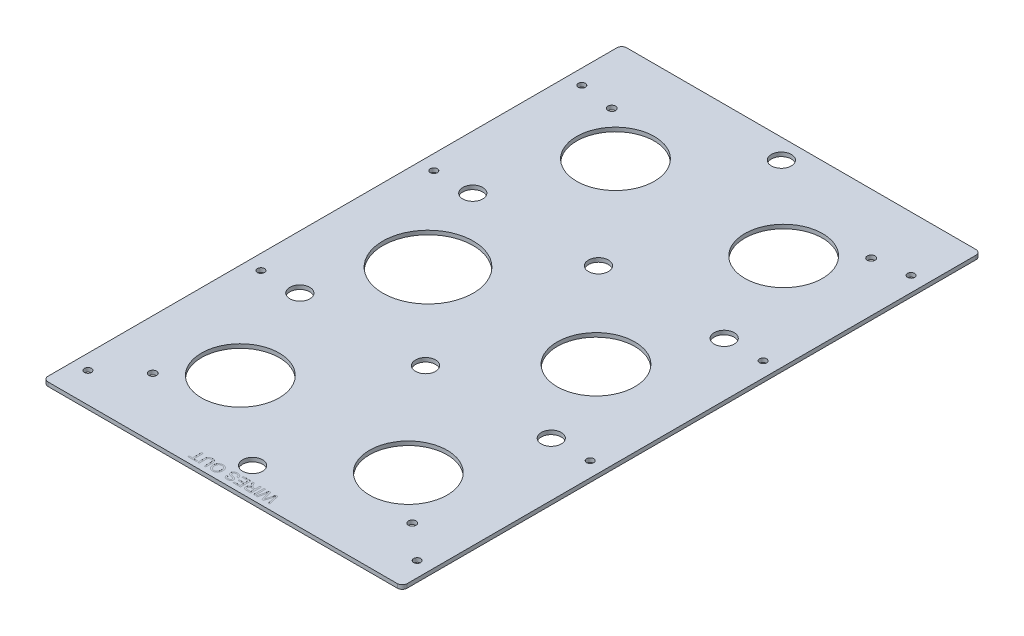
from build123d import *

# Parameters (mm, degrees)
SKETCH1_R           = 24.727
SKETCH1_R_2         = 28.76928198
SKETCH1_R_3         = 6.35
SKETCH1_R_4         = 2.45745
SKETCH1_R_5         = 2.2479
BOSS_EXTRUDE1_DEPTH = 2.54
SKETCH2_W           = 0.941716851
SKETCH2_H           = 6.67762858
CUT_EXTRUDE2_DEPTH  = 0.0254


with BuildPart() as part:
    # Sketch1 → Boss-Extrude1 (new body)
    with BuildSketch(Plane(origin=(0, 0, 0), x_dir=(1, 0, 0), z_dir=(0, 1, 0))):
        with BuildLine():
            Line((447.554094974, -114.738911078), (669.804094974, -114.738911078))
            ThreePointArc((669.804094974, -114.738911078), (672.049159004, -115.668847048), (672.979094974, -117.913911078))
            Line((672.979094974, -117.913911078), (672.979094974, -479.863911078))
            ThreePointArc((672.979094974, -479.863911078), (672.049159004, -482.108975108), (669.804094974, -483.038911078))
            Line((669.804094974, -483.038911078), (447.554094974, -483.038911078))
            ThreePointArc((447.554094974, -483.038911078), (445.309030943, -482.108975108), (444.379094974, -479.863911078))
            Line((444.379094974, -479.863911078), (444.379094974, -117.913911078))
            ThreePointArc((444.379094974, -117.913911078), (445.309030943, -115.668847048), (447.554094974, -114.738911078))
        make_face()
        with Locations((612.196894974, -418.397492761)):
            Circle(SKETCH1_R, mode=Mode.SUBTRACT)
        with Locations((612.196894974, -298.95320192)):
            Circle(SKETCH1_R, mode=Mode.SUBTRACT)
        with Locations((505.161294974, -418.268911078)):
            Circle(SKETCH1_R, mode=Mode.SUBTRACT)
        with Locations((505.161294974, -179.508911078)):
            Circle(SKETCH1_R, mode=Mode.SUBTRACT)
        with Locations((612.196894974, -179.508911078)):
            Circle(SKETCH1_R, mode=Mode.SUBTRACT)
        with Locations((505.161294974, -298.824620236)):
            Circle(SKETCH1_R_2, mode=Mode.SUBTRACT)
        with Locations((558.679094974, -463.988911078)):
            Circle(SKETCH1_R_3, mode=Mode.SUBTRACT)
        with Locations((638.689094974, -353.918011078)):
            Circle(SKETCH1_R_3, mode=Mode.SUBTRACT)
        with Locations((558.679094974, -353.922244411)):
            Circle(SKETCH1_R_3, mode=Mode.SUBTRACT)
        with Locations((478.669094974, -353.918011078)):
            Circle(SKETCH1_R_3, mode=Mode.SUBTRACT)
        with Locations((638.689094974, -243.859811078)):
            Circle(SKETCH1_R_3, mode=Mode.SUBTRACT)
        with Locations((558.679094974, -243.855577744)):
            Circle(SKETCH1_R_3, mode=Mode.SUBTRACT)
        with Locations((478.669094974, -243.859811078)):
            Circle(SKETCH1_R_3, mode=Mode.SUBTRACT)
        with Locations((558.679094974, -127.438911078)):
            Circle(SKETCH1_R_3, mode=Mode.SUBTRACT)
        with Locations((641.229094974, -152.838911078)):
            Circle(SKETCH1_R_4, mode=Mode.SUBTRACT)
        with Locations((476.129094974, -152.838911078)):
            Circle(SKETCH1_R_4, mode=Mode.SUBTRACT)
        with Locations((476.129094974, -444.938911078)):
            Circle(SKETCH1_R_4, mode=Mode.SUBTRACT)
        with Locations((641.229094974, -444.938911078)):
            Circle(SKETCH1_R_4, mode=Mode.SUBTRACT)
        with Locations((453.904094974, -149.663911078)):
            Circle(SKETCH1_R_5, mode=Mode.SUBTRACT)
        with Locations((453.904094974, -243.855577744)):
            Circle(SKETCH1_R_5, mode=Mode.SUBTRACT)
        with Locations((663.454094974, -149.663911078)):
            Circle(SKETCH1_R_5, mode=Mode.SUBTRACT)
        with Locations((663.454094974, -243.855577744)):
            Circle(SKETCH1_R_5, mode=Mode.SUBTRACT)
        with Locations((663.454094974, -353.922244411)):
            Circle(SKETCH1_R_5, mode=Mode.SUBTRACT)
        with Locations((453.904094974, -353.922244411)):
            Circle(SKETCH1_R_5, mode=Mode.SUBTRACT)
        with Locations((453.904094974, -463.988911078)):
            Circle(SKETCH1_R_5, mode=Mode.SUBTRACT)
        with Locations((663.454094974, -463.988911078)):
            Circle(SKETCH1_R_5, mode=Mode.SUBTRACT)
    extrude(amount=BOSS_EXTRUDE1_DEPTH)

    # Sketch2 → Cut-Extrude2 (cut)
    # profile 1 of 8: a face of its own
    with BuildSketch(Plane(origin=(0, 2.54, 0), x_dir=(1, 0, 0), z_dir=(0, 1, 0))):
        with BuildLine():
            Line((583.704685187, -473.038911078), (585.386131326, -479.716539658))
            Line((585.386131326, -479.716539658), (584.413648157, -479.716539658))
            Line((584.413648157, -479.716539658), (583.422437665, -475.324982241))
            add(Edge.make_bspline(
                [(583.422437665, -475.324982241), (583.371066972, -475.098491886), (583.268850039, -474.647823457), (583.167743642, -474.196904586), (583.117449821, -473.972601933)],
                knots=[0, 0, 0, 0, 1.00513078, 2, 2, 2, 2], degree=3))
            add(Edge.make_bspline(
                [(583.117449821, -473.972601933), (583.093637275, -474.053255615), (583.048683526, -474.205515071), (582.987914771, -474.421357522), (582.932720457, -474.609738812), (582.885697734, -474.771537145), (582.847623617, -474.90697984), (582.814750857, -475.014402582), (582.792345195, -475.095909061), (582.779067559, -475.140843853), (582.773669664, -475.159111659)],
                knots=[0, 0, 0, 0, 1.633809233, 3.084334118, 4.356383392, 5.447555203, 6.357852567, 7.089694452, 7.629924063, 8, 8, 8, 8], degree=3))
            Line((582.773669664, -475.159111659), (581.454731006, -479.716539658))
            Line((581.454731006, -479.716539658), (580.321727919, -479.716539658))
            Line((580.321727919, -479.716539658), (579.367972074, -476.371037038))
            add(Edge.make_bspline(
                [(579.367972074, -476.371037038), (579.315338033, -476.164365008), (579.211555093, -475.756852491), (579.073662708, -475.149847502), (578.946392444, -474.557568576), (578.873082381, -474.165840554), (578.83691868, -473.972601933)],
                knots=[0, 0, 0, 0, 1.04154457, 2.053700482, 3.039894486, 4, 4, 4, 4], degree=3))
            add(Edge.make_bspline(
                [(578.83691868, -473.972601933), (578.814538143, -474.071123954), (578.767259555, -474.279250421), (578.694553449, -474.607719652), (578.61203509, -474.968135632), (578.555891598, -475.219280198), (578.526580172, -475.350397894)],
                knots=[0, 0, 0, 0, 0.858436457, 1.813435672, 2.858437265, 4, 4, 4, 4], degree=3))
            Line((578.526580172, -475.350397894), (577.540720343, -479.716539658))
            Line((577.540720343, -479.716539658), (576.568237175, -479.716539658))
            Line((576.568237175, -479.716539658), (578.25102098, -473.038911078))
            Line((578.25102098, -473.038911078), (579.286374449, -473.038911078))
            Line((579.286374449, -473.038911078), (580.681560068, -478.142106798))
            add(Edge.make_bspline(
                [(580.681560068, -478.142106798), (580.695569742, -478.191995279), (580.722182904, -478.286764816), (580.757066528, -478.422004158), (580.791659564, -478.540941594), (580.819174913, -478.645114197), (580.842987144, -478.73347223), (580.864073893, -478.805756997), (580.877636323, -478.863383224), (580.887444042, -478.896136257), (580.891573627, -478.909927072)],
                knots=[0, 0, 0, 0, 1.562239628, 2.967673567, 4.210417925, 5.296319877, 6.215971374, 6.969386481, 7.566055473, 8, 8, 8, 8], degree=3))
            add(Edge.make_bspline(
                [(580.891573627, -478.909927072), (580.916399246, -478.822491273), (580.963424361, -478.65686887), (581.031908734, -478.424002997), (581.090788123, -478.219663107), (581.127429724, -478.093499428), (581.144392498, -478.035093519)],
                knots=[0, 0, 0, 0, 1.197732026, 2.268764715, 3.198546125, 4, 4, 4, 4], degree=3))
            Line((581.144392498, -478.035093519), (582.590409424, -473.038911078))
            Line((582.590409424, -473.038911078), (583.704685187, -473.038911078))
        make_face()
    # profile 2 of 8: a face of its own
    with BuildSketch(Plane(origin=(0, 2.54, 0), x_dir=(1, 0, 0), z_dir=(0, 1, 0))):
        with Locations((575.412493767, -476.377725368)):
            Rectangle(SKETCH2_W, SKETCH2_H)
    # profile 3 of 8: a face of its own
    with BuildSketch(Plane(origin=(0, 2.54, 0), x_dir=(1, 0, 0), z_dir=(0, 1, 0))):
        with BuildLine():
            Line((573.40064413, -473.038911078), (573.40064413, -479.716539658))
            Line((573.40064413, -479.716539658), (570.503259613, -479.716539658))
            add(Edge.make_bspline(
                [(570.503259613, -479.716539658), (570.435034755, -479.716007624), (570.302993526, -479.714977934), (570.111511779, -479.707620013), (569.933205066, -479.691988104), (569.766949623, -479.674529175), (569.613029937, -479.648750724), (569.471372654, -479.618507951), (569.342521062, -479.582764511), (569.225494742, -479.540514282), (569.116911011, -479.49273014), (569.016290738, -479.433739651), (568.919313484, -479.369209991), (568.829844976, -479.292765866), (568.743855584, -479.210634918), (568.664945431, -479.118707702), (568.590779174, -479.01928507), (568.500602804, -478.875311263), (568.405893063, -478.682324631), (568.324317958, -478.437137079), (568.272446963, -478.180396268), (568.266847675, -478.005021348), (568.26400676, -477.916041247)],
                knots=[0, 0, 0, 0, 1.242075696, 2.40389213, 3.487198984, 4.500157661, 5.446319301, 6.326791195, 7.136300648, 7.878370406, 8.590488565, 9.292260633, 9.999224673, 10.708050372, 11.431369221, 12.162165018, 12.910600795, 13.687589445, 15.252257874, 16.810406251, 18.381693487, 20, 20, 20, 20], degree=3))
            add(Edge.make_bspline(
                [(568.26400676, -477.916041247), (568.265313466, -477.85891975), (568.267894299, -477.746100875), (568.287663453, -477.580226748), (568.323434907, -477.421741389), (568.369302238, -477.269253537), (568.432089981, -477.12493565), (568.504793611, -476.985795531), (568.594990125, -476.855821149), (568.695699367, -476.730668634), (568.812805987, -476.61598588), (568.94306826, -476.509991425), (569.090402397, -476.419030361), (569.249976105, -476.334498044), (569.425901855, -476.265075007), (569.615526519, -476.203945773), (569.820317687, -476.156813408), (569.962261495, -476.133072319), (570.03507652, -476.1208935)],
                knots=[0, 0, 0, 0, 0.982645791, 1.940792824, 2.867691729, 3.775150443, 4.675643875, 5.571354211, 6.471357401, 7.392684514, 8.331098131, 9.285922955, 10.275520706, 11.304845665, 12.388884831, 13.524255008, 14.729980297, 16, 16, 16, 16], degree=3))
            add(Edge.make_bspline(
                [(570.03507652, -476.1208935), (569.981146161, -476.094011712), (569.878872059, -476.043032807), (569.739698901, -475.958684466), (569.617777025, -475.879277721), (569.548520366, -475.819733857), (569.516062119, -475.791827668)],
                knots=[0, 0, 0, 0, 1.172551213, 2.223638478, 3.167479604, 4, 4, 4, 4], degree=3))
            add(Edge.make_bspline(
                [(569.516062119, -475.791827668), (569.452873968, -475.730075234), (569.323285476, -475.603431162), (569.146445054, -475.385718714), (568.971463564, -475.146297331), (568.866408332, -474.971826562), (568.812449813, -474.882214801)],
                knots=[0, 0, 0, 0, 0.918170575, 1.883016652, 2.912673989, 4, 4, 4, 4], degree=3))
            Line((568.812449813, -474.882214801), (567.716901374, -473.038911078))
            Line((567.716901374, -473.038911078), (568.796397821, -473.038911078))
            Line((568.796397821, -473.038911078), (569.628426061, -474.448811022))
            add(Edge.make_bspline(
                [(569.628426061, -474.448811022), (569.65834345, -474.498277829), (569.716318436, -474.594136377), (569.800031216, -474.734153326), (569.882219294, -474.862988199), (569.958076937, -474.984651638), (570.032414923, -475.095935127), (570.099053954, -475.20105024), (570.165976922, -475.294042156), (570.242819342, -475.40576136), (570.336663093, -475.526550026), (570.446172116, -475.650635117), (570.546858376, -475.753421697), (570.674091164, -475.851493758), (570.832298465, -475.941288307), (570.965689781, -475.983884438), (571.03030001, -476.004516559)],
                knots=[0, 0, 0, 0, 1.130591283, 2.190900266, 3.190104209, 4.119071823, 4.994606968, 5.807262858, 6.55236009, 7.234593472, 8.459046683, 9.540234366, 10.471327768, 11.266723835, 12.676093724, 14, 14, 14, 14], degree=3))
            add(Edge.make_bspline(
                [(571.03030001, -476.004516559), (571.057442647, -476.009411299), (571.119410102, -476.020586137), (571.224630684, -476.027884442), (571.352118329, -476.035630616), (571.444510797, -476.035404918), (571.494470106, -476.035282877)],
                knots=[0, 0, 0, 0, 0.709978628, 1.620902492, 2.713552433, 4, 4, 4, 4], degree=3))
            Line((571.494470106, -476.035282877), (572.458927279, -476.035282877))
            Line((572.458927279, -476.035282877), (572.458927279, -473.038911078))
            Line((572.458927279, -473.038911078), (573.40064413, -473.038911078))
        make_face()
        with BuildLine():
            Line((572.458927279, -476.805778482), (570.670467861, -476.805778482))
            add(Edge.make_bspline(
                [(570.670467861, -476.805778482), (570.580783678, -476.807169477), (570.41312751, -476.809769811), (570.178746479, -476.832314365), (569.978256618, -476.867554733), (569.809096959, -476.921078915), (569.66693476, -476.992758357), (569.543722449, -477.080415378), (569.440122412, -477.189164531), (569.354920328, -477.313861571), (569.288315551, -477.449755477), (569.24177551, -477.593582493), (569.210530156, -477.742584665), (569.207335369, -477.844540111), (569.205723611, -477.895976257)],
                knots=[0, 0, 0, 0, 1.546056516, 2.890207646, 4.055830773, 5.050253158, 5.937355789, 6.790906573, 7.644595853, 8.512568064, 9.38593768, 10.244184789, 11.114197691, 12, 12, 12, 12], degree=3))
            add(Edge.make_bspline(
                [(569.205723611, -477.895976257), (569.206960947, -477.933460833), (569.209384525, -478.006882105), (569.222224943, -478.114608982), (569.246654953, -478.216697619), (569.28038947, -478.313883923), (569.323102291, -478.406378898), (569.375589591, -478.493818756), (569.437580539, -478.57575689), (569.508691424, -478.652596686), (569.590310946, -478.722524001), (569.683547605, -478.782853263), (569.787656863, -478.834120912), (569.902762329, -478.874810129), (570.028500653, -478.907354943), (570.165587853, -478.929005942), (570.313396936, -478.944672537), (570.415820061, -478.94557834), (570.468480298, -478.946044053)],
                knots=[0, 0, 0, 0, 0.965235723, 1.89061323, 2.787065514, 3.661873922, 4.534873316, 5.404925039, 6.281839248, 7.175200054, 8.095223355, 9.040740021, 10.02630299, 11.075573487, 12.177989335, 13.364883635, 14.645170704, 16, 16, 16, 16], degree=3))
            Line((570.468480298, -478.946044053), (572.458927279, -478.946044053))
            Line((572.458927279, -478.946044053), (572.458927279, -476.805778482))
        make_face(mode=Mode.SUBTRACT)
    # profile 4 of 8: a face of its own
    with BuildSketch(Plane(origin=(0, 2.54, 0), x_dir=(1, 0, 0), z_dir=(0, 1, 0))):
        Polygon((566.723015549, -473.038911078), (566.723015549, -479.716539658), (562.014431294, -479.716539658), (562.014431294, -478.946044053), (565.781298698, -478.946044053), (565.781298698, -476.891389105), (562.271263162, -476.891389105), (562.271263162, -476.1208935), (565.781298698, -476.1208935), (565.781298698, -473.809406683), (561.843210048, -473.809406683), (561.843210048, -473.038911078), align=None)
    # profile 5 of 8: a face of its own
    with BuildSketch(Plane(origin=(0, 2.54, 0), x_dir=(1, 0, 0), z_dir=(0, 1, 0))):
        with BuildLine():
            Line((560.901493197, -475.350397894), (559.959776346, -475.350397894))
            add(Edge.make_bspline(
                [(559.959776346, -475.350397894), (559.949441643, -475.265831844), (559.929588123, -475.103375909), (559.87363622, -474.873323583), (559.803149924, -474.665944967), (559.710403482, -474.481452899), (559.596486816, -474.315456907), (559.453959198, -474.168454605), (559.282808127, -474.039412214), (559.087068688, -473.929072993), (558.872890157, -473.836127961), (558.642163114, -473.77092541), (558.398302582, -473.731386531), (558.231217596, -473.72636178), (558.145901274, -473.72379606)],
                knots=[0, 0, 0, 0, 1.125761249, 2.162647979, 3.12492346, 4.01623828, 4.884793378, 5.777219259, 6.711258599, 7.709587174, 8.742442187, 9.791331093, 10.872217593, 12, 12, 12, 12], degree=3))
            add(Edge.make_bspline(
                [(558.145901274, -473.72379606), (558.070417669, -473.72519974), (557.923680894, -473.727928431), (557.710566725, -473.76049425), (557.510597694, -473.80867252), (557.325934155, -473.877963939), (557.160287267, -473.965063904), (557.013254484, -474.064518239), (556.891306346, -474.183042155), (556.792662447, -474.314041031), (556.716109259, -474.453150197), (556.662739066, -474.596662621), (556.626806756, -474.741783675), (556.622901048, -474.840095913), (556.620962055, -474.88890313)],
                knots=[0, 0, 0, 0, 1.267544124, 2.464049433, 3.614542348, 4.719673496, 5.768837234, 6.754183997, 7.692231426, 8.612479311, 9.501217876, 10.350240008, 11.180974857, 12, 12, 12, 12], degree=3))
            add(Edge.make_bspline(
                [(556.620962055, -474.88890313), (556.623007732, -474.937231481), (556.62701011, -475.031786208), (556.658760129, -475.168660842), (556.71006501, -475.296018864), (556.782033163, -475.414946747), (556.87984428, -475.524725318), (557.00632581, -475.622175985), (557.157954383, -475.714867252), (557.27211533, -475.764299624), (557.332600358, -475.790490002)],
                knots=[0, 0, 0, 0, 0.942081658, 1.843188798, 2.725198023, 3.611401405, 4.541884661, 5.575766242, 6.715586633, 8, 8, 8, 8], degree=3))
            add(Edge.make_bspline(
                [(557.332600358, -475.790490002), (557.35612593, -475.800144256), (557.409274471, -475.821954969), (557.500369464, -475.85082561), (557.608460588, -475.888174698), (557.735759482, -475.926440127), (557.882398046, -475.967439808), (558.047031179, -476.014623884), (558.230964979, -476.063758672), (558.427757945, -476.115775065), (558.626956311, -476.168534701), (558.817239772, -476.222480414), (558.993389362, -476.273645466), (559.154734571, -476.326231572), (559.301429911, -476.378132311), (559.433876155, -476.429012304), (559.552308909, -476.477605417), (559.624641358, -476.513342085), (559.6588015, -476.53021929)],
                knots=[0, 0, 0, 0, 0.499208779, 1.12780332, 1.87546358, 2.745246929, 3.737578632, 4.865834649, 6.108484299, 7.476352792, 8.863398792, 10.155242256, 11.360521946, 12.465428895, 13.487415091, 14.415997097, 15.251929613, 16, 16, 16, 16], degree=3))
            add(Edge.make_bspline(
                [(559.6588015, -476.53021929), (559.737344859, -476.572728755), (559.888953983, -476.654783084), (560.093793376, -476.800625351), (560.263492789, -476.965615264), (560.403438036, -477.143384174), (560.511484943, -477.33485335), (560.587822191, -477.537925687), (560.637398056, -477.751808904), (560.642213266, -477.898820101), (560.644661328, -477.973560884)],
                knots=[0, 0, 0, 0, 1.158956011, 2.237086722, 3.252429106, 4.221720014, 5.165272549, 6.094237939, 7.031106807, 8, 8, 8, 8], degree=3))
            add(Edge.make_bspline(
                [(560.644661328, -477.973560884), (560.641487449, -478.056349046), (560.635174626, -478.221014098), (560.579036526, -478.462602453), (560.489625003, -478.695832438), (560.38663044, -478.880423084), (560.287658383, -479.020579884), (560.204477397, -479.11996029), (560.112690339, -479.212383084), (560.014304466, -479.299765857), (559.905767451, -479.378841254), (559.790330365, -479.45225428), (559.665628506, -479.518040128), (559.489076677, -479.598245304), (559.254248313, -479.680476734), (558.958579395, -479.751721279), (558.647375897, -479.793427053), (558.434962377, -479.799201409), (558.326486182, -479.802150281)],
                knots=[0, 0, 0, 0, 1.200056028, 2.386902731, 3.579012093, 4.815906327, 5.442508847, 6.067203999, 6.694073756, 7.331409728, 7.974631341, 8.640655778, 9.315145047, 10.018831381, 11.453504181, 12.917815188, 14.425977399, 16, 16, 16, 16], degree=3))
            add(Edge.make_bspline(
                [(558.326486182, -479.802150281), (558.207733605, -479.799515114), (557.976941663, -479.794393748), (557.641354111, -479.74922783), (557.327416648, -479.676449439), (557.081665155, -479.590705881), (556.899502856, -479.505477823), (556.771102016, -479.436798514), (556.651510992, -479.35939628), (556.538447673, -479.277441688), (556.435952708, -479.185596336), (556.33979295, -479.088690521), (556.251586122, -478.9848562), (556.146837991, -478.836554819), (556.036193109, -478.638222395), (555.936270997, -478.383839595), (555.872284601, -478.113363396), (555.857816492, -477.927518361), (555.85046645, -477.833105956)],
                knots=[0, 0, 0, 0, 1.607451709, 3.124032445, 4.575401297, 5.965664223, 6.638286369, 7.297495781, 7.935629741, 8.566004073, 9.186263309, 9.796807256, 10.413736732, 11.028594479, 12.253110936, 13.478624344, 14.719098735, 16, 16, 16, 16], degree=3))
            Line((555.85046645, -477.833105956), (556.792183301, -477.833105956))
            add(Edge.make_bspline(
                [(556.792183301, -477.833105956), (556.797970347, -477.880969796), (556.809305526, -477.97472147), (556.841104955, -478.109458987), (556.879141682, -478.236014668), (556.927509761, -478.352966146), (556.985235702, -478.461347583), (557.053708237, -478.559922836), (557.130217308, -478.650557542), (557.216608799, -478.731661115), (557.313700065, -478.802886782), (557.42151144, -478.86444356), (557.539643192, -478.9170562), (557.669241197, -478.957616394), (557.808572579, -478.99129841), (557.95924032, -479.015476198), (558.120717698, -479.028000887), (558.231938693, -479.030415294), (558.289031534, -479.031654676)],
                knots=[0, 0, 0, 0, 1.074256797, 2.104164074, 3.082231143, 4.018364317, 4.921387537, 5.814946689, 6.689553043, 7.561782592, 8.450683137, 9.368204304, 10.325224224, 11.328240899, 12.391723181, 13.519579538, 14.726730929, 16, 16, 16, 16], degree=3))
            add(Edge.make_bspline(
                [(558.289031534, -479.031654676), (558.348377721, -479.031213249), (558.463257343, -479.030358755), (558.629294286, -479.014495465), (558.783313677, -478.99311136), (558.92436606, -478.960285978), (559.05376766, -478.921666158), (559.169248724, -478.869806937), (559.273561651, -478.811347747), (559.36480405, -478.742823708), (559.443447939, -478.666854893), (559.514031858, -478.588817941), (559.570944454, -478.504630312), (559.621058926, -478.418953692), (559.655976583, -478.327231331), (559.683386152, -478.233453781), (559.700052674, -478.135560229), (559.701967222, -478.069045199), (559.702944477, -478.035093519)],
                knots=[0, 0, 0, 0, 1.464224776, 2.834379057, 4.11387117, 5.299348816, 6.406355048, 7.441191667, 8.417293255, 9.352838038, 10.248153785, 11.113750317, 11.944205591, 12.75240885, 13.557683963, 14.358962649, 15.162355132, 16, 16, 16, 16], degree=3))
            add(Edge.make_bspline(
                [(559.702944477, -478.035093519), (559.700510859, -477.977642138), (559.695787431, -477.866134305), (559.647554323, -477.707715286), (559.573371466, -477.563306086), (559.500289532, -477.484733778), (559.463502266, -477.445182822)],
                knots=[0, 0, 0, 0, 1.050964922, 2.039826012, 3.013306874, 4, 4, 4, 4], degree=3))
            add(Edge.make_bspline(
                [(559.463502266, -477.445182822), (559.440311967, -477.425417142), (559.389028052, -477.381706563), (559.293606399, -477.323860815), (559.175297819, -477.265414613), (559.033311147, -477.207316669), (558.867893646, -477.148849914), (558.679298732, -477.08869481), (558.46645156, -477.028641027), (558.236400506, -476.971708106), (558.004320499, -476.913251181), (557.784073918, -476.855650942), (557.581070151, -476.801822493), (557.397646601, -476.745782341), (557.230785076, -476.696627283), (557.083793222, -476.644727132), (556.954030239, -476.597628353), (556.874564229, -476.564383816), (556.837663944, -476.548946614)],
                knots=[0, 0, 0, 0, 0.523895407, 1.158562347, 1.913798076, 2.79478753, 3.797549825, 4.933675542, 6.202127117, 7.604032848, 9.013379355, 10.32225155, 11.523321485, 12.628397413, 13.623935419, 14.51727859, 15.311493772, 16, 16, 16, 16], degree=3))
            add(Edge.make_bspline(
                [(556.837663944, -476.548946614), (556.789642826, -476.526822324), (556.695385417, -476.483396051), (556.562012733, -476.409037643), (556.436752934, -476.332483422), (556.323506524, -476.248124734), (556.216708797, -476.163653215), (556.121806923, -476.072332315), (556.036759509, -475.976310851), (555.936017074, -475.844380858), (555.832678452, -475.666309028), (555.743891949, -475.436163571), (555.688353696, -475.190272403), (555.68231894, -475.020735522), (555.679245204, -474.934383774)],
                knots=[0, 0, 0, 0, 0.899363591, 1.76530001, 2.59691609, 3.395188894, 4.166615117, 4.912545108, 5.632755751, 6.347510175, 7.734752518, 9.118421309, 10.532299558, 12, 12, 12, 12], degree=3))
            add(Edge.make_bspline(
                [(555.679245204, -474.934383774), (555.682785219, -474.847127142), (555.689830999, -474.673458088), (555.748712231, -474.417850397), (555.843189187, -474.170678065), (555.952537103, -473.974585899), (556.056313703, -473.824585042), (556.143462477, -473.716762357), (556.24011311, -473.617066285), (556.343877167, -473.522369915), (556.455563103, -473.434607907), (556.576110276, -473.35374365), (556.70425259, -473.278960579), (556.88721117, -473.187730916), (557.130500458, -473.092992766), (557.439449904, -473.010820741), (557.766235131, -472.962129873), (557.99012047, -472.956284852), (558.104433629, -472.953300455)],
                knots=[0, 0, 0, 0, 1.196987384, 2.382393894, 3.582009067, 4.820735309, 5.454243406, 6.085350439, 6.72189866, 7.359035515, 8.013098289, 8.67027723, 9.350744424, 10.048966745, 11.475869723, 12.9268444, 14.430883741, 16, 16, 16, 16], degree=3))
            add(Edge.make_bspline(
                [(558.104433629, -472.953300455), (558.177129973, -472.953977439), (558.319976733, -472.955307697), (558.529415304, -472.968496322), (558.72954914, -472.992324432), (558.921178925, -473.019904767), (559.103400655, -473.06135733), (559.277259914, -473.108129269), (559.441170819, -473.166806249), (559.59693833, -473.231363773), (559.743136405, -473.307645041), (559.882834696, -473.389400674), (560.012652622, -473.48318437), (560.136436492, -473.582641324), (560.250451465, -473.693285363), (560.356016732, -473.812534511), (560.454279686, -473.94011778), (560.543498247, -474.076173097), (560.623145547, -474.219140407), (560.694848012, -474.366534782), (560.754853707, -474.519142449), (560.804303384, -474.676604641), (560.84478148, -474.838206548), (560.873643596, -475.005024634), (560.894595683, -475.176012368), (560.899180445, -475.29192604), (560.901493197, -475.350397894)],
                knots=[0, 0, 0, 0, 1.259929758, 2.475735005, 3.634725603, 4.752877801, 5.82919746, 6.871690464, 7.871395985, 8.84458164, 9.791640072, 10.727373556, 11.647336026, 12.564665335, 13.477425593, 14.397128332, 15.323044476, 16.266184727, 17.214251675, 18.157898412, 19.105082968, 20.053433368, 21.01687335, 21.990151059, 22.98614553, 24, 24, 24, 24], degree=3))
        make_face()
    # profile 6 of 8: a face of its own
    with BuildSketch(Plane(origin=(0, 2.54, 0), x_dir=(1, 0, 0), z_dir=(0, 1, 0))):
        with BuildLine():
            add(Edge.make_bspline(
                [(552.169209668, -476.289439413), (552.166873126, -476.423315191), (552.162320492, -476.684165353), (552.120284089, -477.064078739), (552.050936075, -477.421100913), (551.955540704, -477.756883394), (551.828661714, -478.068893747), (551.678113348, -478.36096868), (551.495449154, -478.62802459), (551.28905047, -478.873149268), (551.058449384, -479.089837579), (550.812940763, -479.282293084), (550.549439749, -479.442822423), (550.270385906, -479.575367077), (549.974592323, -479.677130938), (549.662889855, -479.748374922), (549.335611769, -479.79433421), (549.111909541, -479.799507081), (548.997603625, -479.802150281)],
                knots=[0, 0, 0, 0, 1.203593535, 2.345140965, 3.431924157, 4.471254512, 5.478692091, 6.45615896, 7.42038538, 8.382007041, 9.33218277, 10.260966195, 11.182476517, 12.100814648, 13.034113903, 13.98924309, 14.972556454, 16, 16, 16, 16], degree=3))
            add(Edge.make_bspline(
                [(548.997603625, -479.802150281), (548.922208644, -479.800845709), (548.772487849, -479.798255063), (548.550741845, -479.778149696), (548.33496047, -479.743241169), (548.125017258, -479.694677819), (547.920602532, -479.633580089), (547.721851237, -479.558120743), (547.528445783, -479.469844934), (547.342117859, -479.367246949), (547.164190757, -479.251797697), (546.995390694, -479.126697102), (546.83834011, -478.989436011), (546.692281093, -478.84183612), (546.556084607, -478.683973329), (546.434103204, -478.512899324), (546.31911696, -478.334017), (546.218303532, -478.143219905), (546.126913801, -477.944892358), (546.050309691, -477.738174777), (545.982470234, -477.526029717), (545.927693672, -477.307139543), (545.886862791, -477.080879739), (545.855465504, -476.848876167), (545.838511687, -476.6098394), (545.835532235, -476.448645271), (545.834023579, -476.36702404)],
                knots=[0, 0, 0, 0, 1.034176269, 2.053687022, 3.051235935, 4.030520976, 5.007759882, 5.975670013, 6.944584641, 7.921900115, 8.890679583, 9.85222947, 10.801660264, 11.7488817, 12.698942795, 13.658174729, 14.62880618, 15.613957309, 16.61577279, 17.622338666, 18.636016077, 19.670029534, 20.714984856, 21.788550191, 22.880224384, 24, 24, 24, 24], degree=3))
            add(Edge.make_bspline(
                [(545.834023579, -476.36702404), (545.835414909, -476.284058486), (545.838163721, -476.120145729), (545.856763311, -475.877996436), (545.889467854, -475.642798747), (545.932844862, -475.413851345), (545.990968729, -475.191630851), (546.060040014, -474.975500145), (546.143585631, -474.766746547), (546.237941143, -474.564866904), (546.344704318, -474.372637815), (546.462471515, -474.191403242), (546.591325391, -474.022859196), (546.729311485, -473.864935494), (546.879188567, -473.720901022), (547.039798976, -473.588611923), (547.210814268, -473.468637382), (547.391564093, -473.360269728), (547.579160691, -473.264982232), (547.771326257, -473.180774534), (547.968287426, -473.112643293), (548.167162617, -473.052213836), (548.370913224, -473.008761971), (548.577617977, -472.976383327), (548.788575561, -472.957449903), (548.930238022, -472.954690712), (549.001616623, -472.953300455)],
                knots=[0, 0, 0, 0, 1.141458971, 2.255149016, 3.338763392, 4.407145747, 5.45911027, 6.497028761, 7.526847988, 8.550472592, 9.561035647, 10.549629976, 11.521388012, 12.477647518, 13.432134385, 14.377847498, 15.337760086, 16.303574593, 17.274809663, 18.230970776, 19.187525402, 20.140611526, 21.088808525, 22.051011914, 23.017975238, 24, 24, 24, 24], degree=3))
            add(Edge.make_bspline(
                [(549.001616623, -472.953300455), (549.078354422, -472.954489343), (549.230352783, -472.956844232), (549.455247878, -472.978525154), (549.673804335, -473.015640338), (549.887272403, -473.062230098), (550.093276567, -473.127640714), (550.29354046, -473.204710539), (550.486579416, -473.29797652), (550.673385143, -473.403334425), (550.852284242, -473.520139128), (551.019483763, -473.649515058), (551.177450737, -473.786919278), (551.321374145, -473.937679006), (551.455564374, -474.097077963), (551.579570767, -474.266499456), (551.691641134, -474.446792165), (551.79115443, -474.636991664), (551.880889017, -474.832271099), (551.956533283, -475.032528558), (552.022998723, -475.234856709), (552.075934487, -475.440490921), (552.118117108, -475.648959956), (552.146482039, -475.859916096), (552.166967359, -476.073673746), (552.16845847, -476.217155589), (552.169209668, -476.289439413)],
                knots=[0, 0, 0, 0, 1.072846099, 2.125039441, 3.155166917, 4.171599398, 5.177324298, 6.174217088, 7.169783185, 8.172042761, 9.17156421, 10.154239632, 11.126115549, 12.096189878, 13.065322046, 14.038037562, 15.029377678, 16.03062832, 17.03785952, 18.032507603, 19.022297599, 20.014323703, 20.999862951, 21.994471951, 22.989647507, 24, 24, 24, 24], degree=3))
        make_face()
        with BuildLine():
            add(Edge.make_bspline(
                [(551.227492817, -476.278738085), (551.226050498, -476.182331479), (551.223238078, -475.9943454), (551.191032897, -475.720278789), (551.142224145, -475.461656512), (551.074749555, -475.217873773), (550.984662749, -474.990722679), (550.874521011, -474.779767032), (550.745322029, -474.584009739), (550.597133785, -474.40566925), (550.434307568, -474.245406413), (550.260308376, -474.105364122), (550.075297856, -473.988587709), (549.881725521, -473.8910491), (549.677024852, -473.815895959), (549.46217656, -473.762769421), (549.237184859, -473.729608328), (549.083776318, -473.72575762), (549.005629621, -473.72379606)],
                knots=[0, 0, 0, 0, 1.215616022, 2.370365452, 3.475740397, 4.533490648, 5.5560781, 6.552384115, 7.530550651, 8.509299237, 9.471863928, 10.40830403, 11.321168121, 12.226759389, 13.137923578, 14.065605683, 15.014614662, 16, 16, 16, 16], degree=3))
            add(Edge.make_bspline(
                [(549.005629621, -473.72379606), (548.926157631, -473.725785217), (548.770551697, -473.729679981), (548.542177913, -473.762281655), (548.325197234, -473.817784607), (548.117459084, -473.891671636), (547.922718837, -473.991554204), (547.736423323, -474.108516507), (547.563646267, -474.251439694), (547.400164861, -474.411990685), (547.253478236, -474.594465892), (547.123534081, -474.794466129), (547.017248342, -475.014476778), (546.928586984, -475.251333757), (546.859039479, -475.506523483), (546.810419261, -475.780043714), (546.78043557, -476.071173449), (546.77733315, -476.2710829), (546.77574043, -476.37371237)],
                knots=[0, 0, 0, 0, 0.976909331, 1.912785716, 2.828990727, 3.727421029, 4.617481149, 5.514840137, 6.426786422, 7.368873452, 8.327895072, 9.299698503, 10.295216142, 11.325792517, 12.405818789, 13.542541501, 14.738390493, 16, 16, 16, 16], degree=3))
            add(Edge.make_bspline(
                [(546.77574043, -476.37371237), (546.776309013, -476.439734433), (546.777424367, -476.569245829), (546.792195411, -476.760147103), (546.811248135, -476.945110274), (546.840256304, -477.123896579), (546.880232892, -477.295765965), (546.924521354, -477.462025647), (546.979898091, -477.62124732), (547.042746398, -477.774039322), (547.11301598, -477.919675351), (547.192475197, -478.056718093), (547.279436079, -478.185622262), (547.374799479, -478.305812428), (547.476154585, -478.418985775), (547.586727909, -478.522200101), (547.704697925, -478.617508813), (547.830079397, -478.703936883), (547.960860173, -478.781629121), (548.096376522, -478.848632477), (548.236196781, -478.905438476), (548.380177194, -478.949950669), (548.527451442, -478.986699959), (548.678374686, -479.013921415), (548.834129506, -479.028192811), (548.939166641, -479.030492434), (548.992252962, -479.031654676)],
                knots=[0, 0, 0, 0, 1.220320263, 2.393826742, 3.538159925, 4.657606474, 5.739544833, 6.799495376, 7.837090465, 8.853610905, 9.852768056, 10.824163015, 11.779900663, 12.724912201, 13.658747054, 14.586045767, 15.518168864, 16.460299482, 17.399069918, 18.328125852, 19.252745725, 20.186143833, 21.111865538, 22.057883325, 23.018444021, 24, 24, 24, 24], degree=3))
            add(Edge.make_bspline(
                [(548.992252962, -479.031654676), (549.067280601, -479.030139437), (549.215760297, -479.027140778), (549.433718789, -478.994736746), (549.644086092, -478.945953073), (549.845394595, -478.875487526), (550.039938697, -478.787023075), (550.225479592, -478.67688147), (550.403198071, -478.547372872), (550.572338874, -478.39904835), (550.72998374, -478.227930937), (550.863330816, -478.026318968), (550.975698346, -477.798879204), (551.0695292, -477.546229974), (551.141070798, -477.266402522), (551.190515453, -476.960604656), (551.22173367, -476.628513077), (551.225524024, -476.398310418), (551.227492817, -476.278738085)],
                knots=[0, 0, 0, 0, 0.895098135, 1.771399171, 2.624879489, 3.470001555, 4.31324378, 5.172350046, 6.041214072, 6.935108351, 7.854676913, 8.809932058, 9.809814619, 10.877726151, 12.02168834, 13.252153056, 14.572707754, 16, 16, 16, 16], degree=3))
        make_face(mode=Mode.SUBTRACT)
    # profile 7 of 8: a face of its own
    with BuildSketch(Plane(origin=(0, 2.54, 0), x_dir=(1, 0, 0), z_dir=(0, 1, 0))):
        with BuildLine():
            Line((540.44055434, -479.716539658), (539.498837489, -479.716539658))
            Line((539.498837489, -479.716539658), (539.498837489, -475.874762959))
            add(Edge.make_bspline(
                [(539.498837489, -475.874762959), (539.499816938, -475.793158881), (539.501722948, -475.634357212), (539.510442015, -475.402755904), (539.527589929, -475.18404963), (539.553268601, -474.978911472), (539.583957127, -474.786071265), (539.620212267, -474.606180294), (539.666412843, -474.439398968), (539.718270586, -474.283896515), (539.780022693, -474.138302785), (539.853045404, -474.000529425), (539.93697045, -473.869711261), (540.032743981, -473.746136221), (540.138843857, -473.629053782), (540.256518677, -473.519390051), (540.386296539, -473.417903754), (540.524886924, -473.320758333), (540.67593951, -473.233880326), (540.839121806, -473.158942965), (541.01338677, -473.09448562), (541.199582928, -473.042665895), (541.396855767, -473.003063948), (541.604919559, -472.973451723), (541.824288823, -472.955947825), (541.974379411, -472.95419598), (542.051104182, -472.953300455)],
                knots=[0, 0, 0, 0, 1.311377147, 2.551942077, 3.723550895, 4.835332178, 5.873100029, 6.860965504, 7.782222652, 8.65229484, 9.493385443, 10.320318369, 11.155067733, 11.987723446, 12.829729107, 13.691560723, 14.568860379, 15.475173283, 16.409214366, 17.364531151, 18.357450607, 19.391849073, 20.466818896, 21.588529868, 22.767281177, 24, 24, 24, 24], degree=3))
            add(Edge.make_bspline(
                [(542.051104182, -472.953300455), (542.126034765, -472.954403093), (542.27203116, -472.956551496), (542.485974248, -472.971088071), (542.689487871, -472.996823618), (542.883155391, -473.030677933), (543.066022983, -473.076174174), (543.237872145, -473.132779585), (543.399822732, -473.198068301), (543.552071516, -473.272611157), (543.692345886, -473.359338901), (543.824260009, -473.451962359), (543.94391161, -473.556335364), (544.053604413, -473.66852584), (544.153502225, -473.789455893), (544.241647678, -473.920278808), (544.32145664, -474.059118375), (544.3876969, -474.209562695), (544.447501129, -474.370135508), (544.497622451, -474.544213222), (544.540419738, -474.731796036), (544.574461527, -474.933317064), (544.603349975, -475.14869783), (544.620551649, -475.378723298), (544.633478123, -475.622243329), (544.63479776, -475.789132871), (544.635474859, -475.874762959)],
                knots=[0, 0, 0, 0, 1.193078897, 2.324621146, 3.412165798, 4.458033356, 5.453301711, 6.409727336, 7.336550967, 8.231923267, 9.10494906, 9.959977801, 10.795507141, 11.62892236, 12.456145611, 13.289107106, 14.138012467, 15.002334476, 15.903094886, 16.864671381, 17.884255983, 18.965082669, 20.117808422, 21.342986352, 22.636701193, 24, 24, 24, 24], degree=3))
            Line((544.635474859, -475.874762959), (544.635474859, -479.716539658))
            Line((544.635474859, -479.716539658), (543.693758008, -479.716539658))
            Line((543.693758008, -479.716539658), (543.693758008, -475.918905936))
            add(Edge.make_bspline(
                [(543.693758008, -475.918905936), (543.69314196, -475.849789935), (543.691953287, -475.71642959), (543.685768405, -475.52324046), (543.673347641, -475.343968185), (543.658182672, -475.178751914), (543.636861524, -475.027833095), (543.610059734, -474.891302271), (543.57977129, -474.768368844), (543.534609035, -474.624483335), (543.458541994, -474.464493985), (543.343327988, -474.291780168), (543.195628055, -474.146747152), (543.02449692, -474.023734386), (542.828938448, -473.927793435), (542.612395608, -473.857956185), (542.375090439, -473.816135264), (542.210014251, -473.811699706), (542.124675811, -473.809406683)],
                knots=[0, 0, 0, 0, 1.090438201, 2.104016592, 3.048763244, 3.925116223, 4.720979001, 5.45216101, 6.119252661, 6.717681473, 7.82855347, 8.901677854, 9.976092604, 11.075141713, 12.213970494, 13.397440122, 14.654570346, 16, 16, 16, 16], degree=3))
            add(Edge.make_bspline(
                [(542.124675811, -473.809406683), (542.051511524, -473.810651046), (541.910238691, -473.813053785), (541.706532063, -473.832465232), (541.519764727, -473.867770204), (541.348062028, -473.913623824), (541.192809029, -473.975108305), (541.05289069, -474.049566738), (540.932007513, -474.141064192), (540.822630208, -474.243773339), (540.730265746, -474.368806378), (540.653082175, -474.517394646), (540.586517926, -474.689660793), (540.532007518, -474.887242207), (540.492199616, -475.110377609), (540.4611008, -475.357672156), (540.444789358, -475.630199902), (540.442006651, -475.819900254), (540.44055434, -475.918905936)],
                knots=[0, 0, 0, 0, 1.111591514, 2.146370713, 3.104407205, 3.996889121, 4.842307775, 5.6365848, 6.396727704, 7.139400744, 7.909024799, 8.745519786, 9.676513234, 10.710427131, 11.854494362, 13.117490512, 14.495602074, 16, 16, 16, 16], degree=3))
            Line((540.44055434, -475.918905936), (540.44055434, -479.716539658))
        make_face()
    # profile 8 of 8: a face of its own
    with BuildSketch(Plane(origin=(0, 2.54, 0), x_dir=(1, 0, 0), z_dir=(0, 1, 0))):
        Polygon((536.331244445, -473.038911078), (536.331244445, -478.946044053), (538.471510015, -478.946044053), (538.471510015, -479.716539658), (533.249262023, -479.716539658), (533.249262023, -478.946044053), (535.389527593, -478.946044053), (535.389527593, -473.038911078), align=None)
    extrude(amount=-CUT_EXTRUDE2_DEPTH, mode=Mode.SUBTRACT)


solid = part.part
